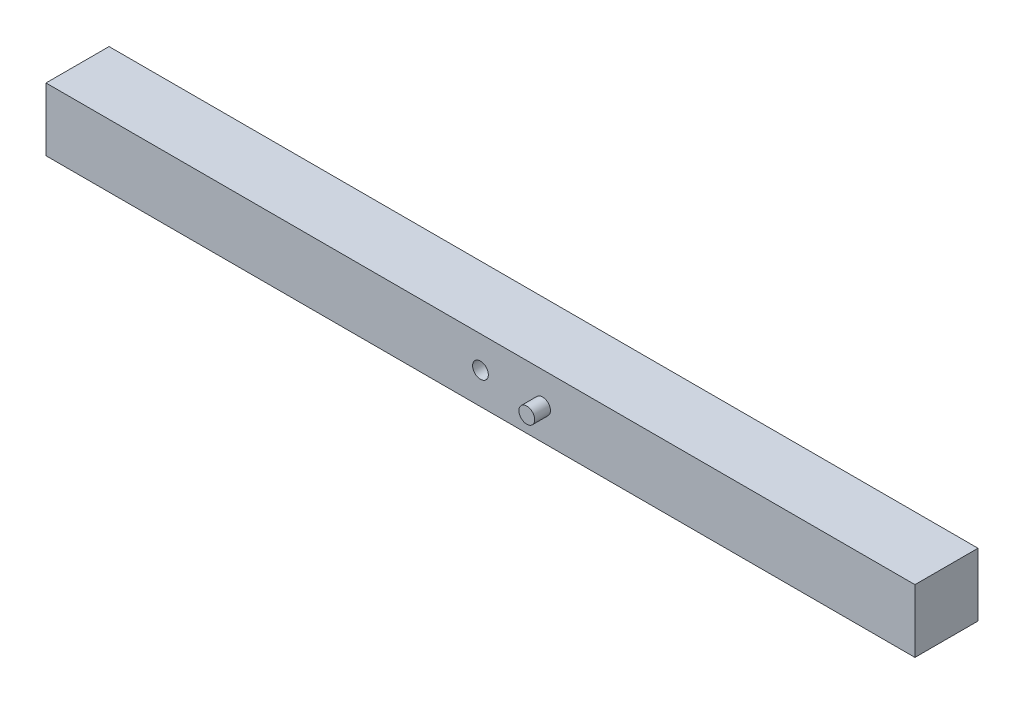
from build123d import *

# Parameters (mm, degrees)
SKETCH1_W           = 700
SKETCH1_H           = 50.8
SKETCH1_R           = 6.35
BOSS_EXTRUDE1_DEPTH = 50.8
SKETCH2_R           = 6.35
BOSS_EXTRUDE2_DEPTH = 12.7


with BuildPart() as part:
    # Sketch1 → Boss-Extrude1 (new body)
    with BuildSketch(Plane.XY):
        with Locations((309.712513069, -8.059143226)):
            Rectangle(SKETCH1_W, SKETCH1_H)
        with Locations((309.712513069, -8.059143226)):
            Circle(SKETCH1_R, mode=Mode.SUBTRACT)
    extrude(amount=BOSS_EXTRUDE1_DEPTH)

    # Sketch2 → Boss-Extrude2 (add)
    with BuildSketch(Plane.XY.offset(50.8)):
        with Locations((359.712513069, -8.059143226)):
            Circle(SKETCH2_R)
    extrude(amount=BOSS_EXTRUDE2_DEPTH)


solid = part.part
